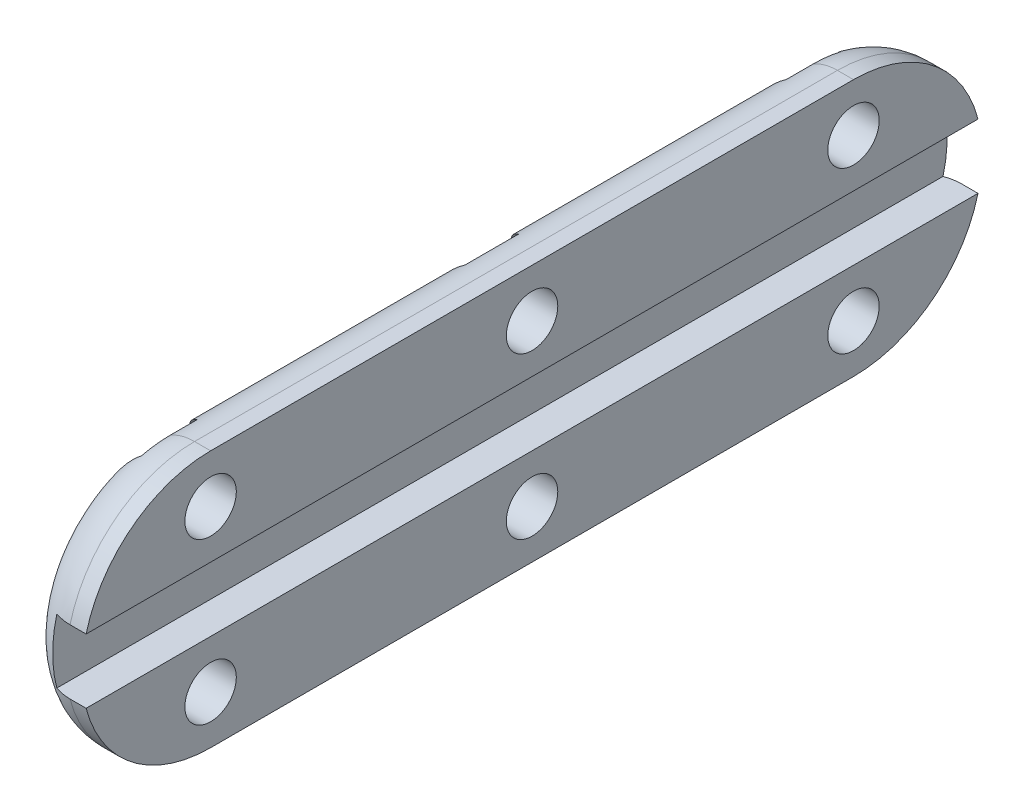
from build123d import *

# Parameters (mm, degrees)
BOSS_EXTRUDE1_DEPTH     = 4
CUT_EXTRUDE1_DEPTH      = 49.826222463
CUT_EXTRUDE1_DEPTH_BACK = 49.826222463
SKETCH2_W               = 2
SKETCH2_H               = 4
CUT_EXTRUDE2_REACH      = 50.826
SKETCH3_R               = 1.6
FILLET1_R               = 3
CUT_EXTRUDE3_DEPTH      = 1.5


with BuildPart() as part:
    # Sketch1 → Boss-Extrude1 (new body)
    with BuildSketch(Plane(origin=(0, 0, 0), x_dir=(0, 0, -1), z_dir=(1, 0, 0))):
        with BuildLine():
            Line((0, -8), (40, -8))
            ThreePointArc((40, -8), (48, 0), (40, 8))
            Line((40, 8), (0, 8))
            ThreePointArc((0, 8), (-8, 0), (0, -8))
        make_face()
    extrude(amount=-BOSS_EXTRUDE1_DEPTH)

    # Sketch2 → Cut-Extrude1 (cut, two sides: drawn at the far end of the back side and taken through both)
    with BuildSketch(Plane.XY.offset(-CUT_EXTRUDE1_DEPTH_BACK)):
        with Locations((-1, 0)):
            Rectangle(SKETCH2_W, SKETCH2_H)
    extrude(amount=CUT_EXTRUDE1_DEPTH + CUT_EXTRUDE1_DEPTH_BACK, mode=Mode.SUBTRACT)

    # Sketch3 → Cut-Extrude2 (cut, up to next)
    with BuildSketch(Plane(origin=(0, 0, 0), x_dir=(0, 0, -1), z_dir=(1, 0, 0)), mode=Mode.PRIVATE) as cut_extrude2_sk1:
        with Locations((0, 5)):
            Circle(SKETCH3_R)
    cut_extrude2_tool1 = extrude(cut_extrude2_sk1.sketch, amount=-CUT_EXTRUDE2_REACH, mode=Mode.PRIVATE) & part.part
    # Sketch3 → Cut-Extrude2 (cut, up to next)
    with BuildSketch(Plane(origin=(0, 0, 0), x_dir=(0, 0, -1), z_dir=(1, 0, 0)), mode=Mode.PRIVATE) as cut_extrude2_sk2:
        with Locations((40, 5)):
            Circle(SKETCH3_R)
    cut_extrude2_tool2 = extrude(cut_extrude2_sk2.sketch, amount=-CUT_EXTRUDE2_REACH, mode=Mode.PRIVATE) & part.part
    # Sketch3 → Cut-Extrude2 (cut, up to next)
    with BuildSketch(Plane(origin=(0, 0, 0), x_dir=(0, 0, -1), z_dir=(1, 0, 0)), mode=Mode.PRIVATE) as cut_extrude2_sk3:
        with Locations((40, -5)):
            Circle(SKETCH3_R)
    cut_extrude2_tool3 = extrude(cut_extrude2_sk3.sketch, amount=-CUT_EXTRUDE2_REACH, mode=Mode.PRIVATE) & part.part
    # Sketch3 → Cut-Extrude2 (cut, up to next)
    with BuildSketch(Plane(origin=(0, 0, 0), x_dir=(0, 0, -1), z_dir=(1, 0, 0)), mode=Mode.PRIVATE) as cut_extrude2_sk4:
        with Locations((0, -5)):
            Circle(SKETCH3_R)
    cut_extrude2_tool4 = extrude(cut_extrude2_sk4.sketch, amount=-CUT_EXTRUDE2_REACH, mode=Mode.PRIVATE) & part.part
    # Sketch3 → Cut-Extrude2 (cut, up to next)
    with BuildSketch(Plane(origin=(0, 0, 0), x_dir=(0, 0, -1), z_dir=(1, 0, 0)), mode=Mode.PRIVATE) as cut_extrude2_sk5:
        with Locations((20, 5)):
            Circle(SKETCH3_R)
    cut_extrude2_tool5 = extrude(cut_extrude2_sk5.sketch, amount=-CUT_EXTRUDE2_REACH, mode=Mode.PRIVATE) & part.part
    # Sketch3 → Cut-Extrude2 (cut, up to next)
    with BuildSketch(Plane(origin=(0, 0, 0), x_dir=(0, 0, -1), z_dir=(1, 0, 0)), mode=Mode.PRIVATE) as cut_extrude2_sk6:
        with Locations((20, -5)):
            Circle(SKETCH3_R)
    cut_extrude2_tool6 = extrude(cut_extrude2_sk6.sketch, amount=-CUT_EXTRUDE2_REACH, mode=Mode.PRIVATE) & part.part
    add(cut_extrude2_tool1.solids().sort_by_distance((0, 5, 0))[0], mode=Mode.SUBTRACT)
    add(cut_extrude2_tool2.solids().sort_by_distance((0, 5, -40))[0], mode=Mode.SUBTRACT)
    add(cut_extrude2_tool3.solids().sort_by_distance((0, -5, -40))[0], mode=Mode.SUBTRACT)
    add(cut_extrude2_tool4.solids().sort_by_distance((0, -5, 0))[0], mode=Mode.SUBTRACT)
    add(cut_extrude2_tool5.solids().sort_by_distance((0, 5, -20))[0], mode=Mode.SUBTRACT)
    add(cut_extrude2_tool6.solids().sort_by_distance((0, -5, -20))[0], mode=Mode.SUBTRACT)

    # Fillet1
    # the kernel refuses this fillet: 3 mm, written as the material it takes off along each edge
    with BuildSketch(Plane(origin=(-4, -8, 0), x_dir=(0, 1, 0), z_dir=(0, 0, -1))) as fillet1_piece_1:
        with BuildLine():
            CenterArc((FILLET1_R, FILLET1_R), FILLET1_R, 180, 90)
            Line((0, FILLET1_R), (0, 0))
            Line((0, 0), (FILLET1_R, 0))
        make_face()
    extrude(amount=40, mode=Mode.SUBTRACT)
    with BuildSketch(Plane(origin=(-4, 0, 0), x_dir=(0, 1, 0), z_dir=(0, 0, -1))) as fillet1_piece_2:
        with BuildLine():
            CenterArc((8 - FILLET1_R, FILLET1_R), FILLET1_R, 270, 90)
            Line((8 - FILLET1_R, 0), (8, 0))
            Line((8, 0), (8, FILLET1_R))
        make_face()
    revolve(axis=Axis((-4, 0, 0), (1, 0, 0)), revolution_arc=180, mode=Mode.SUBTRACT)
    with BuildSketch(Plane(origin=(-4, 8, -40), x_dir=(1, 0, 0), z_dir=(0, 0, 1))) as fillet1_piece_3:
        with BuildLine():
            CenterArc((FILLET1_R, -FILLET1_R), FILLET1_R, 90, 90)
            Line((0, -FILLET1_R), (0, 0))
            Line((0, 0), (FILLET1_R, 0))
        make_face()
    extrude(amount=40, mode=Mode.SUBTRACT)
    with BuildSketch(Plane(origin=(-4, 0, -40), x_dir=(0, -1, 0), z_dir=(0, 0, 1))) as fillet1_piece_4:
        with BuildLine():
            CenterArc((8 - FILLET1_R, FILLET1_R), FILLET1_R, 270, 90)
            Line((8 - FILLET1_R, 0), (8, 0))
            Line((8, 0), (8, FILLET1_R))
        make_face()
    revolve(axis=Axis((-4, 0, -40), (1, 0, 0)), revolution_arc=180, mode=Mode.SUBTRACT)

    # Sketch4 → Cut-Extrude3 (cut)
    with BuildSketch(Plane.ZY.offset(4)):
        Polygon((-36.824573519, 5), (-38.41228676, 7.75), (-41.58771324, 7.75), (-43.175426481, 5), (-41.58771324, 2.25), (-38.41228676, 2.25), align=None)
        Polygon((-3.175426481, 5), (-1.58771324, 2.25), (1.58771324, 2.25), (3.175426481, 5), (1.58771324, 7.75), (-1.58771324, 7.75), align=None)
        Polygon((-3.175426481, -5), (-1.58771324, -7.75), (1.58771324, -7.75), (3.175426481, -5), (1.58771324, -2.25), (-1.58771324, -2.25), align=None)
        Polygon((-36.824573519, -5), (-38.41228676, -2.25), (-41.58771324, -2.25), (-43.175426481, -5), (-41.58771324, -7.75), (-38.41228676, -7.75), align=None)
        Polygon((-16.824573519, 5), (-18.41228676, 7.75), (-21.58771324, 7.75), (-23.175426481, 5), (-21.58771324, 2.25), (-18.41228676, 2.25), align=None)
        Polygon((-16.824573519, -5), (-18.41228676, -2.25), (-21.58771324, -2.25), (-23.175426481, -5), (-21.58771324, -7.75), (-18.41228676, -7.75), align=None)
    extrude(amount=-CUT_EXTRUDE3_DEPTH, mode=Mode.SUBTRACT)


solid = part.part
